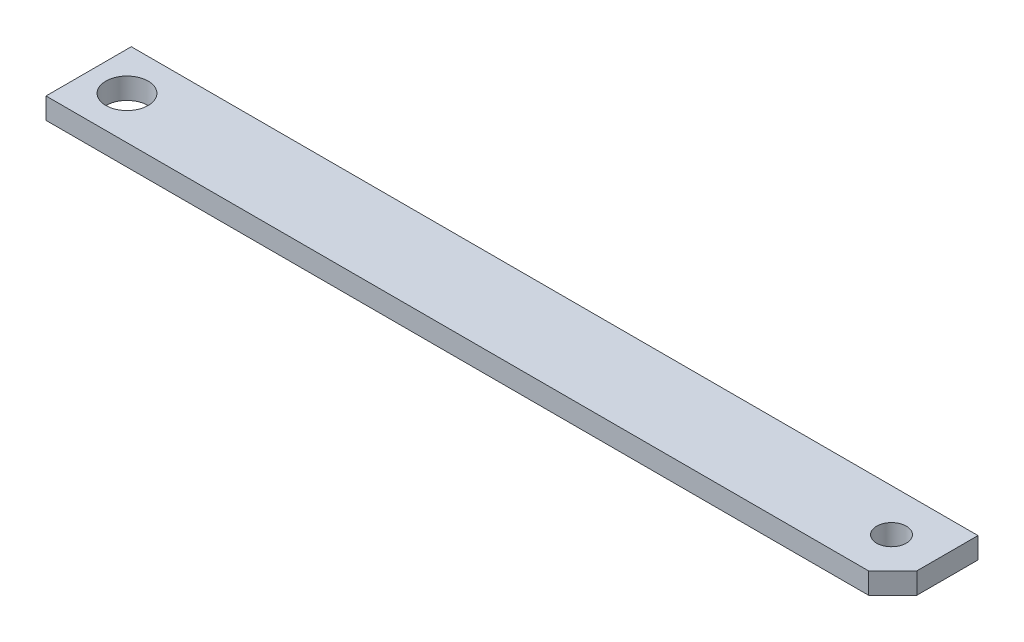
from build123d import *

# Parameters (mm, degrees)
SZKIC1_R                    = 10
SZKIC1_R_2                  = 7
DODANIE_WYCI_GNI_CIE1_DEPTH = 10


with BuildPart() as part:
    # Szkic1 → Dodanie-wyciągnięcie1 (new body)
    with BuildSketch(Plane(origin=(0, 0, 0), x_dir=(1, 0, 0), z_dir=(0, 1, 0))):
        Polygon((370.596208974, -20.21727097), (381.990910382, -8.822569562), (381.990910382, 20.082223448), (-18.047279612, 20.082223448), (-18.047279612, -20.21727097), align=None)
        Circle(SZKIC1_R, mode=Mode.SUBTRACT)
        with Locations((361.2, 0)):
            Circle(SZKIC1_R_2, mode=Mode.SUBTRACT)
    extrude(amount=DODANIE_WYCI_GNI_CIE1_DEPTH)


solid = part.part
